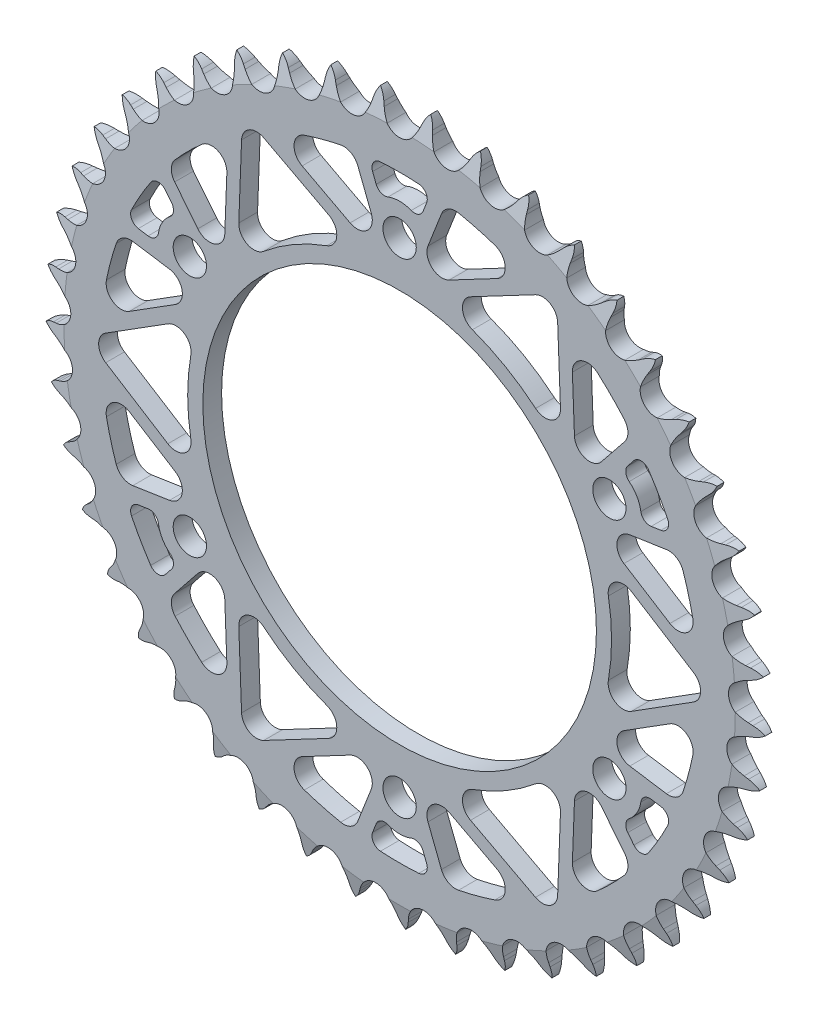
from build123d import *

# Parameters (mm, degrees)
BOSS_EXTRUDE2_DEPTH      = 6.1976
M10_CLEARANCE_HOLE1_D    = 11
SKETCH5_R                = 65
CUT_EXTRUDE1_DEPTH       = 169.066931826
CUT_EXTRUDE5_DEPTH       = 169.066931826
FILLET5_R                = 5
FILLET6_R                = 5
FILLET7_R                = 3
CIRPATTERN1_COUNT        = 6
FILLET5_OF_CIRPATTERN1_R = 5
FILLET6_OF_CIRPATTERN1_R = 5
FILLET7_OF_CIRPATTERN1_R = 3


with BuildPart() as part:
    # Sketch2 → Boss-Extrude2 (new body)
    with BuildSketch(Plane.XY):
        with BuildLine():
            Line((5.956451436, 114.157319132), (6.387056113, 115.368083346))
            ThreePointArc((6.387056113, 115.368083346), (7.1593932, 117.045110566), (8.28683305, 118.507233768))
            ThreePointArc((8.28683305, 118.507233768), (9.199812512, 116.902430548), (9.731236189, 115.134235494))
            Line((9.731236189, 115.134235494), (9.989144441, 113.875325767))
            ThreePointArc((9.989144441, 113.875325767), (10.526532851, 112.014172711), (11.32913636, 110.251077533))
            ThreePointArc((11.32913636, 110.251077533), (15.123673948, 107.610531699), (19.499050656, 109.102870958))
            ThreePointArc((19.499050656, 109.102870958), (20.75653756, 110.57643931), (21.786111761, 112.217370132))
            Line((21.786111761, 112.217370132), (22.381031633, 113.356422684))
            ThreePointArc((22.381031633, 113.356422684), (23.379249467, 114.909640643), (24.69920537, 116.200625263))
            ThreePointArc((24.69920537, 116.200625263), (25.379954338, 114.484377695), (25.660121047, 112.659430712))
            Line((25.660121047, 112.659430712), (25.740312983, 111.376878716))
            ThreePointArc((25.740312983, 111.376878716), (26.013449124, 109.459048263), (26.562866328, 107.601410587))
            ThreePointArc((26.562866328, 107.601410587), (29.952982785, 104.458464801), (34.493472111, 105.327345972))
            ThreePointArc((34.493472111, 105.327345972), (35.943802315, 106.611565307), (37.191730202, 108.093237669))
            Line((37.191730202, 108.093237669), (37.939385831, 109.138408195))
            ThreePointArc((37.939385831, 109.138408195), (39.144055237, 110.537585273), (40.630835752, 111.632303763))
            ThreePointArc((40.630835752, 111.632303763), (41.066104223, 109.838016654), (41.089560838, 107.99183826))
            Line((41.089560838, 107.99183826), (40.990475613, 106.710607411))
            ThreePointArc((40.990475613, 106.710607411), (40.994043201, 104.773427948), (41.279580318, 102.857404578))
            ThreePointArc((41.279580318, 102.857404578), (44.199290883, 99.273232705), (48.816517366, 99.501744005))
            ThreePointArc((48.816517366, 99.501744005), (50.431461843, 100.571618453), (51.873453919, 101.865193288))
            Line((51.873453919, 101.865193288), (52.759293038, 102.796138735))
            ThreePointArc((52.759293038, 102.796138735), (54.146966498, 104.01404154), (55.771633134, 104.891186451))
            ThreePointArc((55.771633134, 104.891186451), (55.9529491, 103.053783557), (55.719239065, 101.222307515))
            Line((55.719239065, 101.222307515), (55.442805261, 99.967335515))
            ThreePointArc((55.442805261, 99.967335515), (55.176734856, 98.048512037), (55.192834232, 96.111396188))
            ThreePointArc((55.192834232, 96.111396188), (57.585310061, 92.155760056), (62.189404639, 91.739453773))
            ThreePointArc((62.189404639, 91.739453773), (63.937530332, 92.574159445), (65.545519861, 93.65445879))
            Line((65.545519861, 93.65445879), (66.55230062, 94.453059362))
            ThreePointArc((66.55230062, 94.453059362), (68.095968646, 95.465982803), (69.826899116, 96.108481506))
            ThreePointArc((69.826899116, 96.108481506), (69.750733469, 94.263725785), (69.264405684, 92.482599692))
            Line((69.264405684, 92.482599692), (68.81600377, 91.278313143))
            ThreePointArc((68.81600377, 91.278313143), (68.28547413, 89.415193367), (68.031822408, 87.494688797))
            ThreePointArc((68.031822408, 87.494688797), (69.85049668, 83.244580363), (74.35184589, 82.191559424))
            ThreePointArc((74.35184589, 82.191559424), (76.199127521, 82.774849725), (77.941816816, 83.620846782))
            Line((77.941816816, 83.620846782), (79.049943371, 84.271558628))
            ThreePointArc((79.049943371, 84.271558628), (80.719560223, 85.059787301), (82.523063933, 85.45513429))
            ThreePointArc((82.523063933, 85.45513429), (82.190899151, 83.638931815), (81.461419433, 81.942823264))
            Line((81.461419433, 81.942823264), (80.849777042, 80.812662234))
            ThreePointArc((80.849777042, 80.812662234), (80.065114323, 79.041509666), (79.546648547, 77.174996811))
            ThreePointArc((79.546648547, 77.174996811), (80.756122835, 72.713139603), (85.067113035, 71.043899863))
            ThreePointArc((85.067113035, 71.043899863), (86.977595368, 71.36442171), (88.821064964, 71.959650108))
            Line((88.821064964, 71.959650108), (90.008968894, 72.449807863))
            ThreePointArc((90.008968894, 72.449807863), (91.772037378, 72.997999794), (93.61301118, 73.138500089))
            ThreePointArc((93.61301118, 73.138500089), (93.031312472, 71.386201174), (92.072879314, 69.80812299))
            Line((92.072879314, 69.80812299), (91.30990137, 68.774084777))
            ThreePointArc((91.30990137, 68.774084777), (90.28637814, 67.129372889), (89.513189654, 65.353181298))
            ThreePointArc((89.513189654, 65.353181298), (90.089922918, 60.76642029), (94.126645586, 58.513451603))
            ThreePointArc((94.126645586, 58.513451603), (96.063143256, 58.564966402), (97.971512115, 58.897840698))
            Line((97.971512115, 58.897840698), (99.21607222, 59.217903998))
            ThreePointArc((99.21607222, 59.217903998), (101.038276214, 59.515389255), (102.880887647, 59.398308178))
            ThreePointArc((102.880887647, 59.398308178), (102.060977118, 57.744019328), (100.892245331, 56.314687007))
            Line((100.892245331, 56.314687007), (99.99278233, 55.39689799))
            ThreePointArc((99.99278233, 55.39689799), (98.750320304, 53.910639226), (97.737458344, 52.259340449))
            ThreePointArc((97.737458344, 52.259340449), (97.670225127, 47.636951727), (101.354110049, 44.844105565))
            ThreePointArc((101.354110049, 44.844105565), (103.278931331, 44.62561064), (105.215055224, 44.689651814))
            Line((105.215055224, 44.689651814), (106.492047557, 44.833390991))
            ThreePointArc((106.492047557, 44.833390991), (108.337919933, 44.874379361), (110.146304662, 44.501995762))
            ThreePointArc((110.146304662, 44.501995762), (109.104140936, 42.977915829), (107.747858555, 41.725149699))
            Line((107.747858555, 41.725149699), (106.729417523, 40.941473596))
            ThreePointArc((106.729417523, 40.941473596), (105.292199811, 39.642596294), (104.059378583, 38.148330983))
            ThreePointArc((104.059378583, 38.148330983), (103.349487502, 33.580284085), (106.608832049, 30.301920022))
            ThreePointArc((106.608832049, 30.301920022), (108.484512486, 29.817668128), (110.410706963, 29.611629692))
            Line((110.410706963, 29.611629692), (111.695276321, 29.576247026))
            ThreePointArc((111.695276321, 29.576247026), (113.528889273, 29.359940718), (115.267849146, 28.739502619))
            ThreePointArc((115.267849146, 28.739502619), (114.023716755, 27.375296085), (112.506282274, 26.323479813))
            Line((112.506282274, 26.323479813), (111.388686007, 25.689169989))
            ThreePointArc((111.388686007, 25.689169989), (109.784686417, 24.602955317), (108.355901383, 23.294807647))
            ThreePointArc((108.355901383, 23.294807647), (107.017169662, 18.87001441), (109.788534398, 15.169942073))
            ThreePointArc((109.788534398, 15.169942073), (111.578566005, 14.429358622), (113.457339881, 13.95725088))
            Line((113.457339881, 13.95725088), (114.724483584, 13.743435054))
            ThreePointArc((114.724483584, 13.743435054), (116.51014792, 13.274044224), (118.145836061, 12.417627749))
            ThreePointArc((118.145836061, 12.417627749), (116.723950628, 11.239847342), (115.074899183, 10.409453336))
            Line((115.074899183, 10.409453336), (113.87990042, 9.936855909))
            ThreePointArc((113.87990042, 9.936855909), (112.14033898, 9.0844458), (110.543399816, 7.987877377))
            ThreePointArc((110.543399816, 7.987877377), (108.601884344, 3.79246137), (110.831327808, -0.257301542))
            ThreePointArc((110.831327808, -0.257301542), (112.500869655, -1.239801935), (114.295654735, -1.968789944))
            Line((114.295654735, -1.968789944), (115.52070927, -2.356877247))
            ThreePointArc((115.52070927, -2.356877247), (117.223669066, -3.070216441), (118.724248666, -4.145942121))
            ThreePointArc((118.724248666, -4.145942121), (117.152285573, -5.114372245), (115.403714074, -5.70718131))
            Line((115.403714074, -5.70718131), (114.154572108, -6.008867768))
            ThreePointArc((114.154572108, -6.008867768), (112.313307402, -6.61088212), (110.579296712, -7.474527839))
            ThreePointArc((110.579296712, -7.474527839), (108.07278688, -11.358907618), (109.716915491, -15.679537076))
            ThreePointArc((109.716915491, -15.679537076), (111.233471845, -16.884831159), (112.909334678, -17.856510512))
            Line((112.909334678, -17.856510512), (114.068455753, -18.411315614))
            ThreePointArc((114.068455753, -18.411315614), (115.655564835, -19.354718836), (116.991828818, -20.628815943))
            ThreePointArc((116.991828818, -20.628815943), (115.300384538, -21.369046394), (113.486326941, -21.712732164))
            Line((113.486326941, -21.712732164), (112.207354899, -21.837635669))
            ThreePointArc((112.207354899, -21.837635669), (110.30022505, -22.17753674), (108.462893381, -22.791449874))
            ThreePointArc((108.462893381, -22.791449874), (105.44017555, -26.289188389), (106.466988215, -30.796588256))
            ThreePointArc((106.466988215, -30.796588256), (107.801041032, -32.20121635), (109.325362854, -33.396674413))
            Line((109.325362854, -33.396674413), (110.395989497, -34.107398665))
            ThreePointArc((110.395989497, -34.107398665), (111.836356589, -35.262503644), (112.982296098, -36.710173328))
            ThreePointArc((112.982296098, -36.710173328), (111.20429267, -37.207796361), (109.360057543, -37.295669384))
            Line((109.360057543, -37.295669384), (108.076149161, -37.241358831))
            ThreePointArc((108.076149161, -37.241358831), (106.140274282, -37.312530834), (104.235383204, -37.664762261))
            ThreePointArc((104.235383204, -37.664762261), (100.75529114, -40.707780012), (101.144802118, -45.314218876))
            ThreePointArc((101.144802118, -45.314218876), (102.270385577, -46.890841493), (103.613497198, -48.286810036))
            Line((103.613497198, -48.286810036), (104.574790878, -49.139619998))
            ThreePointArc((104.574790878, -49.139619998), (105.840380875, -50.483943929), (106.773691501, -52.077008946))
            ThreePointArc((106.773691501, -52.077008946), (104.943735739, -52.322338896), (103.10521902, -52.152688823))
            Line((103.10521902, -52.152688823), (101.841364114, -51.920221306))
            ThreePointArc((101.841364114, -51.920221306), (99.914423809, -51.721278957), (97.979049859, -51.804972894))
            ThreePointArc((97.979049859, -51.804972894), (94.109319595, -54.334041002), (93.853947498, -58.949859769))
            ThreePointArc((93.853947498, -58.949859769), (94.749153398, -60.667789744), (95.884912678, -62.237097826))
            Line((95.884912678, -62.237097826), (96.718162906, -63.215394522))
            ThreePointArc((96.718162906, -63.215394522), (97.784342539, -64.72277167), (98.486858451, -66.430224822))
            ThreePointArc((98.486858451, -66.430224822), (96.640568363, -66.41848662), (94.843554689, -65.994615497))
            Line((94.843554689, -65.994615497), (93.624352758, -65.588515731))
            ThreePointArc((93.624352758, -65.588515731), (91.743852726, -65.123331218), (89.815665758, -64.936858657))
            ThreePointArc((89.815665758, -64.936858657), (85.631617192, -66.902751687), (84.736332548, -71.438108697))
            ThreePointArc((84.736332548, -71.438108697), (85.383736723, -73.263908476), (86.2900374, -74.976011301))
            Line((86.2900374, -74.976011301), (86.979025909, -76.060753299))
            ThreePointArc((86.979025909, -76.060753299), (87.825043203, -77.701844282), (88.283090729, -79.490451935))
            ThreePointArc((88.283090729, -79.490451935), (86.456402251, -79.221874051), (84.735868449, -78.552032047))
            Line((84.735868449, -78.552032047), (83.585049871, -77.980204303))
            ThreePointArc((83.585049871, -77.980204303), (81.787591908, -77.257831913), (79.904121887, -76.804822331))
            ThreePointArc((79.904121887, -76.804822331), (75.487192765, -78.169276411), (73.96942127, -82.535896099))
            ThreePointArc((73.96942127, -82.535896099), (74.356422735, -84.434028567), (75.015624697, -86.255602))
            Line((75.015624697, -86.255602), (75.54694111, -87.425676031))
            ThreePointArc((75.54694111, -87.425676031), (76.156329301, -89.168538879), (76.360993066, -91.00348782))
            ThreePointArc((76.360993066, -91.00348782), (74.589460612, -90.483297818), (72.978894916, -89.580522646))
            Line((72.978894916, -89.580522646), (71.918859065, -88.8540969))
            ThreePointArc((71.918859065, -88.8540969), (70.239428645, -87.88859679), (68.437335173, -87.177867502))
            ThreePointArc((68.437335173, -87.177867502), (63.873495996, -87.914325087), (61.762779346, -92.027216166))
            ThreePointArc((61.762779346, -92.027216166), (61.881845558, -93.960736333), (62.281118189, -95.85632552))
            Line((62.281118189, -95.85632552), (62.644421036, -97.088957424))
            ThreePointArc((62.644421036, -97.088957424), (63.005319075, -98.899669295), (62.952615532, -100.74524433))
            ThreePointArc((62.952615532, -100.74524433), (61.270719966, -99.983567116), (59.801470205, -98.865430267))
            Line((59.801470205, -98.865430267), (58.852849474, -97.99854557))
            ThreePointArc((58.852849474, -97.99854557), (57.324134799, -96.808710101), (55.638493576, -95.854094646))
            ThreePointArc((55.638493576, -95.854094646), (51.016574283, -95.948221425), (48.353995177, -99.72733115))
            ThreePointArc((48.353995177, -99.72733115), (48.202808647, -101.658605246), (48.334380559, -103.591314699))
            Line((48.334380559, -103.591314699), (48.522598563, -104.862512698))
            ThreePointArc((48.522598563, -104.862512698), (48.627981981, -106.705830144), (48.318936945, -108.526109255))
            ThreePointArc((48.318936945, -108.526109255), (46.759414451, -107.537770009), (45.460077899, -106.226034747))
            Line((45.460077899, -106.226034747), (44.641336112, -105.235564023))
            ThreePointArc((44.641336112, -105.235564023), (43.293091875, -103.844551989), (41.75671199, -102.66463087))
            ThreePointArc((41.75671199, -102.66463087), (37.166672982, -102.114594773), (34.004055493, -105.486367071))
            ThreePointArc((34.004055493, -105.486367071), (33.585558896, -107.377805042), (33.446869191, -109.310016771))
            Line((33.446869191, -109.310016771), (33.456338903, -110.595038441))
            ThreePointArc((33.456338903, -110.595038441), (33.304156532, -112.435083386), (32.744785212, -114.194636909))
            ThreePointArc((32.744785212, -114.194636909), (31.337990121, -112.998872532), (30.233856888, -111.51907029))
            Line((30.233856888, -111.51907029), (29.560929921, -110.424291926))
            ThreePointArc((29.560929921, -110.424291926), (28.419398163, -108.859177794), (27.062183502, -107.476916833))
            ThreePointArc((27.062183502, -107.476916833), (22.593364667, -106.293423688), (18.992265548, -109.192230846))
            ThreePointArc((18.992265548, -109.192230846), (18.314604443, -111.007018004), (17.908352559, -112.901123704))
            Line((17.908352559, -112.901123704), (17.738889662, -114.174957562))
            ThreePointArc((17.738889662, -114.174957562), (17.332103558, -115.975915623), (16.533293482, -117.640495851))
            ThreePointArc((16.533293482, -117.640495851), (15.30660746, -116.260580536), (14.419168243, -114.641513981))
            Line((14.419168243, -114.641513981), (13.905153855, -113.463736592))
            ThreePointArc((13.905153855, -113.463736592), (12.992553192, -111.754983529), (11.840920395, -110.197286863))
            ThreePointArc((11.840920395, -110.197286863), (7.580302209, -108.403372017), (3.610812758, -110.772792052))
            ThreePointArc((3.610812758, -110.772792052), (2.687177048, -112.475605628), (2.021270215, -114.294738688))
            Line((2.021270215, -114.294738688), (1.676173111, -115.532591005))
            ThreePointArc((1.676173111, -115.532591005), (1.022700904, -117.259408583), (0, -118.796616355))
            ThreePointArc((0, -118.796616355), (-1.022700904, -117.259408583), (-1.676173111, -115.532591005))
            Line((-1.676173111, -115.532591005), (-2.021270215, -114.294738688))
            ThreePointArc((-2.021270215, -114.294738688), (-2.687177048, -112.475605628), (-3.610812758, -110.772792052))
            ThreePointArc((-3.610812758, -110.772792052), (-7.580302209, -108.403372017), (-11.840920395, -110.197286863))
            ThreePointArc((-11.840920395, -110.197286863), (-12.992553192, -111.754983529), (-13.905153855, -113.463736592))
            Line((-13.905153855, -113.463736592), (-14.419168243, -114.641513981))
            ThreePointArc((-14.419168243, -114.641513981), (-15.30660746, -116.260580536), (-16.533293482, -117.640495851))
            ThreePointArc((-16.533293482, -117.640495851), (-17.332103558, -115.975915623), (-17.738889662, -114.174957562))
            Line((-17.738889662, -114.174957562), (-17.908352559, -112.901123704))
            ThreePointArc((-17.908352559, -112.901123704), (-18.314604443, -111.007018004), (-18.992265548, -109.192230846))
            ThreePointArc((-18.992265548, -109.192230846), (-22.593364667, -106.293423688), (-27.062183502, -107.476916833))
            ThreePointArc((-27.062183502, -107.476916833), (-28.419398163, -108.859177794), (-29.560929921, -110.424291926))
            Line((-29.560929921, -110.424291926), (-30.233856888, -111.51907029))
            ThreePointArc((-30.233856888, -111.51907029), (-31.337990121, -112.998872532), (-32.744785212, -114.194636909))
            ThreePointArc((-32.744785212, -114.194636909), (-33.304156532, -112.435083386), (-33.456338903, -110.595038441))
            Line((-33.456338903, -110.595038441), (-33.446869191, -109.310016771))
            ThreePointArc((-33.446869191, -109.310016771), (-33.585558896, -107.377805042), (-34.004055493, -105.486367071))
            ThreePointArc((-34.004055493, -105.486367071), (-37.166672982, -102.114594773), (-41.75671199, -102.66463087))
            ThreePointArc((-41.75671199, -102.66463087), (-43.293091875, -103.844551989), (-44.641336112, -105.235564023))
            Line((-44.641336112, -105.235564023), (-45.460077899, -106.226034747))
            ThreePointArc((-45.460077899, -106.226034747), (-46.759414451, -107.537770009), (-48.318936945, -108.526109255))
            ThreePointArc((-48.318936945, -108.526109255), (-48.627981981, -106.705830144), (-48.522598563, -104.862512698))
            Line((-48.522598563, -104.862512698), (-48.334380559, -103.591314699))
            ThreePointArc((-48.334380559, -103.591314699), (-48.202808647, -101.658605246), (-48.353995177, -99.72733115))
            ThreePointArc((-48.353995177, -99.72733115), (-51.016574283, -95.948221425), (-55.638493576, -95.854094646))
            ThreePointArc((-55.638493576, -95.854094646), (-57.324134799, -96.808710101), (-58.852849474, -97.99854557))
            Line((-58.852849474, -97.99854557), (-59.801470205, -98.865430267))
            ThreePointArc((-59.801470205, -98.865430267), (-61.270719966, -99.983567116), (-62.952615532, -100.74524433))
            ThreePointArc((-62.952615532, -100.74524433), (-63.005319075, -98.899669295), (-62.644421036, -97.088957424))
            Line((-62.644421036, -97.088957424), (-62.281118189, -95.85632552))
            ThreePointArc((-62.281118189, -95.85632552), (-61.881845558, -93.960736333), (-61.762779346, -92.027216166))
            ThreePointArc((-61.762779346, -92.027216166), (-63.873495996, -87.914325087), (-68.437335173, -87.177867502))
            ThreePointArc((-68.437335173, -87.177867502), (-70.239428645, -87.88859679), (-71.918859065, -88.8540969))
            Line((-71.918859065, -88.8540969), (-72.978894916, -89.580522646))
            ThreePointArc((-72.978894916, -89.580522646), (-74.589460612, -90.483297818), (-76.360993066, -91.00348782))
            ThreePointArc((-76.360993066, -91.00348782), (-76.156329301, -89.168538879), (-75.54694111, -87.425676031))
            Line((-75.54694111, -87.425676031), (-75.015624697, -86.255602))
            ThreePointArc((-75.015624697, -86.255602), (-74.356422735, -84.434028567), (-73.96942127, -82.535896099))
            ThreePointArc((-73.96942127, -82.535896099), (-75.487192765, -78.169276411), (-79.904121887, -76.804822331))
            ThreePointArc((-79.904121887, -76.804822331), (-81.787591908, -77.257831913), (-83.585049871, -77.980204303))
            Line((-83.585049871, -77.980204303), (-84.735868449, -78.552032047))
            ThreePointArc((-84.735868449, -78.552032047), (-86.456402251, -79.221874051), (-88.283090729, -79.490451935))
            ThreePointArc((-88.283090729, -79.490451935), (-87.825043203, -77.701844282), (-86.979025909, -76.060753299))
            Line((-86.979025909, -76.060753299), (-86.2900374, -74.976011301))
            ThreePointArc((-86.2900374, -74.976011301), (-85.383736723, -73.263908476), (-84.736332548, -71.438108697))
            ThreePointArc((-84.736332548, -71.438108697), (-85.631617192, -66.902751687), (-89.815665758, -64.936858657))
            ThreePointArc((-89.815665758, -64.936858657), (-91.743852726, -65.123331218), (-93.624352758, -65.588515731))
            Line((-93.624352758, -65.588515731), (-94.843554689, -65.994615497))
            ThreePointArc((-94.843554689, -65.994615497), (-96.640568363, -66.41848662), (-98.486858451, -66.430224822))
            ThreePointArc((-98.486858451, -66.430224822), (-97.784342539, -64.72277167), (-96.718162906, -63.215394522))
            Line((-96.718162906, -63.215394522), (-95.884912678, -62.237097826))
            ThreePointArc((-95.884912678, -62.237097826), (-94.749153398, -60.667789744), (-93.853947498, -58.949859769))
            ThreePointArc((-93.853947498, -58.949859769), (-94.109319595, -54.334041002), (-97.979049859, -51.804972894))
            ThreePointArc((-97.979049859, -51.804972894), (-99.914423809, -51.721278957), (-101.841364114, -51.920221306))
            Line((-101.841364114, -51.920221306), (-103.10521902, -52.152688823))
            ThreePointArc((-103.10521902, -52.152688823), (-104.943735739, -52.322338896), (-106.773691501, -52.077008946))
            ThreePointArc((-106.773691501, -52.077008946), (-105.840380875, -50.483943929), (-104.574790878, -49.139619998))
            Line((-104.574790878, -49.139619998), (-103.613497198, -48.286810036))
            ThreePointArc((-103.613497198, -48.286810036), (-102.270385577, -46.890841493), (-101.144802118, -45.314218876))
            ThreePointArc((-101.144802118, -45.314218876), (-100.75529114, -40.707780012), (-104.235383204, -37.664762261))
            ThreePointArc((-104.235383204, -37.664762261), (-106.140274282, -37.312530834), (-108.076149161, -37.241358831))
            Line((-108.076149161, -37.241358831), (-109.360057543, -37.295669384))
            ThreePointArc((-109.360057543, -37.295669384), (-111.20429267, -37.207796361), (-112.982296098, -36.710173328))
            ThreePointArc((-112.982296098, -36.710173328), (-111.836356589, -35.262503644), (-110.395989497, -34.107398665))
            Line((-110.395989497, -34.107398665), (-109.325362854, -33.396674413))
            ThreePointArc((-109.325362854, -33.396674413), (-107.801041032, -32.20121635), (-106.466988215, -30.796588256))
            ThreePointArc((-106.466988215, -30.796588256), (-105.44017555, -26.289188389), (-108.462893381, -22.791449874))
            ThreePointArc((-108.462893381, -22.791449874), (-110.30022505, -22.17753674), (-112.207354899, -21.837635669))
            Line((-112.207354899, -21.837635669), (-113.486326941, -21.712732164))
            ThreePointArc((-113.486326941, -21.712732164), (-115.300384538, -21.369046394), (-116.991828818, -20.628815943))
            ThreePointArc((-116.991828818, -20.628815943), (-115.655564835, -19.354718836), (-114.068455753, -18.411315614))
            Line((-114.068455753, -18.411315614), (-112.909334678, -17.856510512))
            ThreePointArc((-112.909334678, -17.856510512), (-111.233471845, -16.884831159), (-109.716915491, -15.679537076))
            ThreePointArc((-109.716915491, -15.679537076), (-108.07278688, -11.358907618), (-110.579296712, -7.474527839))
            ThreePointArc((-110.579296712, -7.474527839), (-112.313307402, -6.61088212), (-114.154572108, -6.008867768))
            Line((-114.154572108, -6.008867768), (-115.403714074, -5.70718131))
            ThreePointArc((-115.403714074, -5.70718131), (-117.152285573, -5.114372245), (-118.724248666, -4.145942121))
            ThreePointArc((-118.724248666, -4.145942121), (-117.223669066, -3.070216441), (-115.52070927, -2.356877247))
            Line((-115.52070927, -2.356877247), (-114.295654735, -1.968789944))
            ThreePointArc((-114.295654735, -1.968789944), (-112.500869655, -1.239801935), (-110.831327808, -0.257301542))
            ThreePointArc((-110.831327808, -0.257301542), (-108.601884344, 3.79246137), (-110.543399816, 7.987877377))
            ThreePointArc((-110.543399816, 7.987877377), (-112.14033898, 9.0844458), (-113.87990042, 9.936855909))
            Line((-113.87990042, 9.936855909), (-115.074899183, 10.409453336))
            ThreePointArc((-115.074899183, 10.409453336), (-116.723950628, 11.239847342), (-118.145836061, 12.417627749))
            ThreePointArc((-118.145836061, 12.417627749), (-116.51014792, 13.274044224), (-114.724483584, 13.743435054))
            Line((-114.724483584, 13.743435054), (-113.457339881, 13.95725088))
            ThreePointArc((-113.457339881, 13.95725088), (-111.578566005, 14.429358622), (-109.788534398, 15.169942073))
            ThreePointArc((-109.788534398, 15.169942073), (-107.017169662, 18.87001441), (-108.355901383, 23.294807647))
            ThreePointArc((-108.355901383, 23.294807647), (-109.784686417, 24.602955317), (-111.388686007, 25.689169989))
            Line((-111.388686007, 25.689169989), (-112.506282274, 26.323479813))
            ThreePointArc((-112.506282274, 26.323479813), (-114.023716755, 27.375296085), (-115.267849146, 28.739502619))
            ThreePointArc((-115.267849146, 28.739502619), (-113.528889273, 29.359940718), (-111.695276321, 29.576247026))
            Line((-111.695276321, 29.576247026), (-110.410706963, 29.611629692))
            ThreePointArc((-110.410706963, 29.611629692), (-108.484512486, 29.817668128), (-106.608832049, 30.301920022))
            ThreePointArc((-106.608832049, 30.301920022), (-103.349487502, 33.580284085), (-104.059378583, 38.148330983))
            ThreePointArc((-104.059378583, 38.148330983), (-105.292199811, 39.642596294), (-106.729417523, 40.941473596))
            Line((-106.729417523, 40.941473596), (-107.747858555, 41.725149699))
            ThreePointArc((-107.747858555, 41.725149699), (-109.104140936, 42.977915829), (-110.146304662, 44.501995762))
            ThreePointArc((-110.146304662, 44.501995762), (-108.337919933, 44.874379361), (-106.492047557, 44.833390991))
            Line((-106.492047557, 44.833390991), (-105.215055224, 44.689651814))
            ThreePointArc((-105.215055224, 44.689651814), (-103.278931331, 44.62561064), (-101.354110049, 44.844105565))
            ThreePointArc((-101.354110049, 44.844105565), (-97.670225127, 47.636951727), (-97.737458344, 52.259340449))
            ThreePointArc((-97.737458344, 52.259340449), (-98.750320304, 53.910639226), (-99.99278233, 55.39689799))
            Line((-99.99278233, 55.39689799), (-100.892245331, 56.314687007))
            ThreePointArc((-100.892245331, 56.314687007), (-102.060977118, 57.744019328), (-102.880887647, 59.398308178))
            ThreePointArc((-102.880887647, 59.398308178), (-101.038276214, 59.515389255), (-99.21607222, 59.217903998))
            Line((-99.21607222, 59.217903998), (-97.971512115, 58.897840698))
            ThreePointArc((-97.971512115, 58.897840698), (-96.063143256, 58.564966402), (-94.126645586, 58.513451603))
            ThreePointArc((-94.126645586, 58.513451603), (-90.089922918, 60.76642029), (-89.513189654, 65.353181298))
            ThreePointArc((-89.513189654, 65.353181298), (-90.28637814, 67.129372889), (-91.30990137, 68.774084777))
            Line((-91.30990137, 68.774084777), (-92.072879314, 69.80812299))
            ThreePointArc((-92.072879314, 69.80812299), (-93.031312472, 71.386201174), (-93.61301118, 73.138500089))
            ThreePointArc((-93.61301118, 73.138500089), (-91.772037378, 72.997999794), (-90.008968894, 72.449807863))
            Line((-90.008968894, 72.449807863), (-88.821064964, 71.959650108))
            ThreePointArc((-88.821064964, 71.959650108), (-86.977595368, 71.36442171), (-85.067113035, 71.043899863))
            ThreePointArc((-85.067113035, 71.043899863), (-80.756122835, 72.713139603), (-79.546648547, 77.174996811))
            ThreePointArc((-79.546648547, 77.174996811), (-80.065114323, 79.041509666), (-80.849777042, 80.812662234))
            Line((-80.849777042, 80.812662234), (-81.461419433, 81.942823264))
            ThreePointArc((-81.461419433, 81.942823264), (-82.190899151, 83.638931815), (-82.523063933, 85.45513429))
            ThreePointArc((-82.523063933, 85.45513429), (-80.719560223, 85.059787301), (-79.049943371, 84.271558628))
            Line((-79.049943371, 84.271558628), (-77.941816816, 83.620846782))
            ThreePointArc((-77.941816816, 83.620846782), (-76.199127521, 82.774849725), (-74.35184589, 82.191559424))
            ThreePointArc((-74.35184589, 82.191559424), (-69.85049668, 83.244580363), (-68.031822408, 87.494688797))
            ThreePointArc((-68.031822408, 87.494688797), (-68.28547413, 89.415193367), (-68.81600377, 91.278313143))
            Line((-68.81600377, 91.278313143), (-69.264405684, 92.482599692))
            ThreePointArc((-69.264405684, 92.482599692), (-69.750733469, 94.263725785), (-69.826899116, 96.108481506))
            ThreePointArc((-69.826899116, 96.108481506), (-68.095968646, 95.465982803), (-66.55230062, 94.453059362))
            Line((-66.55230062, 94.453059362), (-65.545519861, 93.65445879))
            ThreePointArc((-65.545519861, 93.65445879), (-63.937530332, 92.574159445), (-62.189404639, 91.739453773))
            ThreePointArc((-62.189404639, 91.739453773), (-57.585310061, 92.155760056), (-55.192834232, 96.111396188))
            ThreePointArc((-55.192834232, 96.111396188), (-55.176734856, 98.048512037), (-55.442805261, 99.967335515))
            Line((-55.442805261, 99.967335515), (-55.719239065, 101.222307515))
            ThreePointArc((-55.719239065, 101.222307515), (-55.9529491, 103.053783557), (-55.771633134, 104.891186451))
            ThreePointArc((-55.771633134, 104.891186451), (-54.146966498, 104.01404154), (-52.759293038, 102.796138735))
            Line((-52.759293038, 102.796138735), (-51.873453919, 101.865193288))
            ThreePointArc((-51.873453919, 101.865193288), (-50.431461843, 100.571618453), (-48.816517366, 99.501744005))
            ThreePointArc((-48.816517366, 99.501744005), (-44.199290883, 99.273232705), (-41.279580318, 102.857404578))
            ThreePointArc((-41.279580318, 102.857404578), (-40.994043201, 104.773427948), (-40.990475613, 106.710607411))
            Line((-40.990475613, 106.710607411), (-41.089560838, 107.99183826))
            ThreePointArc((-41.089560838, 107.99183826), (-41.066104223, 109.838016654), (-40.630835752, 111.632303763))
            ThreePointArc((-40.630835752, 111.632303763), (-39.144055237, 110.537585273), (-37.939385831, 109.138408195))
            Line((-37.939385831, 109.138408195), (-37.191730202, 108.093237669))
            ThreePointArc((-37.191730202, 108.093237669), (-35.943802315, 106.611565307), (-34.493472111, 105.327345972))
            ThreePointArc((-34.493472111, 105.327345972), (-29.952982785, 104.458464801), (-26.562866328, 107.601410587))
            ThreePointArc((-26.562866328, 107.601410587), (-26.013449124, 109.459048263), (-25.740312983, 111.376878716))
            Line((-25.740312983, 111.376878716), (-25.660121047, 112.659430712))
            ThreePointArc((-25.660121047, 112.659430712), (-25.379954338, 114.484377695), (-24.69920537, 116.200625263))
            ThreePointArc((-24.69920537, 116.200625263), (-23.379249467, 114.909640643), (-22.381031633, 113.356422684))
            Line((-22.381031633, 113.356422684), (-21.786111761, 112.217370132))
            ThreePointArc((-21.786111761, 112.217370132), (-20.75653756, 110.57643931), (-19.499050656, 109.102870958))
            ThreePointArc((-19.499050656, 109.102870958), (-15.123673948, 107.610531699), (-11.32913636, 110.251077533))
            ThreePointArc((-11.32913636, 110.251077533), (-10.526532851, 112.014172711), (-9.989144441, 113.875325767))
            Line((-9.989144441, 113.875325767), (-9.731236189, 115.134235494))
            ThreePointArc((-9.731236189, 115.134235494), (-9.199812512, 116.902430548), (-8.28683305, 118.507233768))
            ThreePointArc((-8.28683305, 118.507233768), (-7.1593932, 117.045110566), (-6.387056113, 115.368083346))
            Line((-6.387056113, 115.368083346), (-5.956451436, 114.157319132))
            ThreePointArc((-5.956451436, 114.157319132), (-5.165270411, 112.389068701), (-4.125102361, 110.754832664))
            ThreePointArc((-4.125102361, 110.754832664), (0, 108.668082003), (4.125102361, 110.754832664))
            ThreePointArc((4.125102361, 110.754832664), (5.165270411, 112.389068701), (5.956451436, 114.157319132))
        make_face()
    extrude(amount=BOSS_EXTRUDE2_DEPTH)

    # Sketch4 → Cut-Revolve1 (revolve, cut)
    with BuildSketch(Plane(origin=(0, 0, 0), x_dir=(0, 0, -1), z_dir=(0.9781476007338068, 0.2079116908177541, 0))):
        Polygon((-4.213225, 118.796616355), (-6.1976, 118.796616355), (-6.1976, 110.859116355), align=None)
        Polygon((0, 110.859116355), (-1.984375, 118.796616355), (0, 118.796616355), align=None)
        Polygon((0, 118.796616355), (0, 110.859116355), (-1.984375, 118.796616355), align=None)
    revolve(axis=Axis((0, 0, -0.30988), (0, 0, 1)), mode=Mode.SUBTRACT)

    # M10 Clearance Hole1 (through all)
    with Locations(Plane.XY.offset(6.1976)):
        with Locations((0, 80), (69.282032303, 40), (69.282032303, -40), (0, -80), (-69.282032303, -40), (-69.282032303, 40)):
            Hole(M10_CLEARANCE_HOLE1_D / 2)

    # Sketch5 → Cut-Extrude1 (cut, through all)
    with BuildSketch(Plane.XY.offset(6.1976)):
        Circle(SKETCH5_R)
    extrude(amount=-CUT_EXTRUDE1_DEPTH, mode=Mode.SUBTRACT)

    # Sketch9 → Cut-Extrude5 (cut, through all)
    with BuildSketch(Plane.XY.offset(6.1976)):
        with BuildLine():
            Line((-41.767986929, 89.52456011), (-4.483177356, 69.856289057))
            Line((-4.483177356, 69.856289057), (-15.311261123, 97.594963383))
            ThreePointArc((-15.311261123, 97.594963383), (-28.823479869, 94.490309573), (-41.767986929, 89.52456011))
        make_face()
        with BuildLine():
            Line((6.490002191, 88.254082115), (10.388494251, 98.240983211))
            ThreePointArc((10.388494251, 98.240983211), (0, 98.788722003), (-10.388494251, 98.240983211))
            Line((-10.388494251, 98.240983211), (-6.490002191, 88.254082115))
            ThreePointArc((-6.490002191, 88.254082115), (0, 90.5), (6.490002191, 88.254082115))
        make_face()
        with BuildLine():
            Line((15.311261123, 97.594963383), (4.483177356, 69.856289057))
            Line((4.483177356, 69.856289057), (41.767986929, 89.52456011))
            ThreePointArc((41.767986929, 89.52456011), (28.823479869, 94.490309573), (15.311261123, 97.594963383))
        make_face()
        with BuildLine():
            Line((-52.122198971, 83.919532705), (-53.608497729, 45.012542376))
            ThreePointArc((-53.608497729, 45.012542376), (-35, 60.621778265), (-12.177756322, 68.932592081))
            Line((-12.177756322, 68.932592081), (-46.615347711, 87.098914763))
            ThreePointArc((-46.615347711, 87.098914763), (-49.394361002, 85.553542862), (-52.122198971, 83.919532705))
        make_face()
        with BuildLine():
            Line((-46.615347711, 87.098914763), (-51.894361002, 89.883669881))
            Line((-51.894361002, 89.883669881), (-52.122198971, 83.919532705))
            ThreePointArc((-52.122198971, 83.919532705), (-49.394361002, 85.553542862), (-46.615347711, 87.098914763))
        make_face()
    cut_extrude5 = extrude(amount=-CUT_EXTRUDE5_DEPTH, mode=Mode.SUBTRACT)

    # Fillet5
    fillet5_edges = [part.edges().sort_by_distance(p)[0] for p in [
        (-51.894361002, 89.883669881, 3.0988),
        (-12.177756322, 68.932592081, 3.0988),
        (-53.608497729, 45.012542376, 3.0988),
    ]]
    fillet(fillet5_edges, radius=FILLET5_R)

    # Fillet6
    fillet6_edges = [part.edges().sort_by_distance(p)[0] for p in [
        (41.767986929, 89.52456011, 3.0988),
        (4.483177356, 69.856289057, 3.0988),
        (15.311261123, 97.594963383, 3.0988),
        (-15.311261123, 97.594963383, 3.0988),
        (-4.483177356, 69.856289057, 3.0988),
        (-41.767986929, 89.52456011, 3.0988),
    ]]
    fillet(fillet6_edges, radius=FILLET6_R)

    # Fillet7
    fillet7_edges = [part.edges().sort_by_distance(p)[0] for p in [
        (6.490002191, 88.254082115, 3.0988),
        (-6.490002191, 88.254082115, 3.0988),
        (-10.388494251, 98.240983211, 3.0988),
        (10.388494251, 98.240983211, 3.0988),
    ]]
    fillet(fillet7_edges, radius=FILLET7_R)

    # CirPattern1: Cut-Extrude5 ×6 about axis
    cirpattern1_axis = Axis((0, 0, 0), (0, 0, 1))
    for i in range(1, CIRPATTERN1_COUNT):
        add(cut_extrude5.rotate(cirpattern1_axis, i * 360 / CIRPATTERN1_COUNT), mode=Mode.SUBTRACT)

    # Fillet5 of CirPattern1
    fillet5_of_cirpattern1_edges = [part.edges().sort_by_distance(p)[0] for p in [
        (-103.788722003, 0, 3.0988),
        (-65.786254052, 23.920049704, 3.0988),
        (-65.786254052, -23.920049704, 3.0988),
        (-51.894361002, -89.883669881, 3.0988),
        (-53.608497729, -45.012542376, 3.0988),
        (-12.177756322, -68.932592081, 3.0988),
        (51.894361001, -89.883669881, 3.0988),
        (12.177756322, -68.932592081, 3.0988),
        (53.608497729, -45.012542376, 3.0988),
        (103.788722003, 0, 3.0988),
        (65.786254052, -23.920049704, 3.0988),
        (65.786254052, 23.920049704, 3.0988),
        (51.894361001, 89.883669881, 3.0988),
        (53.608497729, 45.012542376, 3.0988),
        (12.177756322, 68.932592081, 3.0988),
    ]]
    fillet(fillet5_of_cirpattern1_edges, radius=FILLET5_OF_CIRPATTERN1_R)

    # Fillet6 of CirPattern1
    fillet6_of_cirpattern1_edges = [part.edges().sort_by_distance(p)[0] for p in [
        (-56.646549853, 80.9344178, 3.0988),
        (-58.255732259, 38.810690008, 3.0988),
        (-76.86408701, 62.057422788, 3.0988),
        (-92.175348133, 35.537540596, 3.0988),
        (-62.738909615, 31.045599049, 3.0988),
        (-98.414536782, 8.590142309, 3.0988),
        (-98.414536782, -8.590142309, 3.0988),
        (-62.738909615, -31.045599049, 3.0988),
        (-92.175348133, -35.537540596, 3.0988),
        (-76.86408701, -62.057422788, 3.0988),
        (-58.255732259, -38.810690008, 3.0988),
        (-56.646549853, -80.9344178, 3.0988),
        (-41.767986929, -89.52456011, 3.0988),
        (-4.483177356, -69.856289057, 3.0988),
        (-15.311261123, -97.594963383, 3.0988),
        (15.311261123, -97.594963383, 3.0988),
        (4.483177356, -69.856289057, 3.0988),
        (41.767986929, -89.52456011, 3.0988),
        (56.646549853, -80.9344178, 3.0988),
        (58.255732259, -38.810690008, 3.0988),
        (76.86408701, -62.057422788, 3.0988),
        (92.175348133, -35.537540596, 3.0988),
        (62.738909615, -31.045599049, 3.0988),
        (98.414536782, -8.590142309, 3.0988),
        (98.414536782, 8.590142309, 3.0988),
        (62.738909615, 31.045599049, 3.0988),
        (92.175348133, 35.537540596, 3.0988),
        (76.86408701, 62.057422788, 3.0988),
        (58.255732259, 38.810690008, 3.0988),
        (56.646549853, 80.9344178, 3.0988),
    ]]
    fillet(fillet6_of_cirpattern1_edges, radius=FILLET6_OF_CIRPATTERN1_R)

    # Fillet7 of CirPattern1
    fillet7_of_cirpattern1_edges = [part.edges().sort_by_distance(p)[0] for p in [
        (-73.185276004, 49.747547825, 3.0988),
        (-79.675278195, 38.50653429, 3.0988),
        (-90.273434279, 40.123791677, 3.0988),
        (-79.884940027, 58.117191534, 3.0988),
        (-79.675278195, -38.50653429, 3.0988),
        (-73.185276004, -49.747547825, 3.0988),
        (-79.884940027, -58.117191534, 3.0988),
        (-90.273434279, -40.123791677, 3.0988),
        (-6.490002191, -88.254082115, 3.0988),
        (6.490002191, -88.254082115, 3.0988),
        (10.388494251, -98.240983211, 3.0988),
        (-10.388494251, -98.240983211, 3.0988),
        (73.185276004, -49.747547825, 3.0988),
        (79.675278195, -38.50653429, 3.0988),
        (90.273434279, -40.123791677, 3.0988),
        (79.884940027, -58.117191534, 3.0988),
        (79.675278195, 38.50653429, 3.0988),
        (73.185276004, 49.747547825, 3.0988),
        (79.884940027, 58.117191534, 3.0988),
        (90.273434279, 40.123791677, 3.0988),
    ]]
    fillet(fillet7_of_cirpattern1_edges, radius=FILLET7_OF_CIRPATTERN1_R)


solid = part.part
